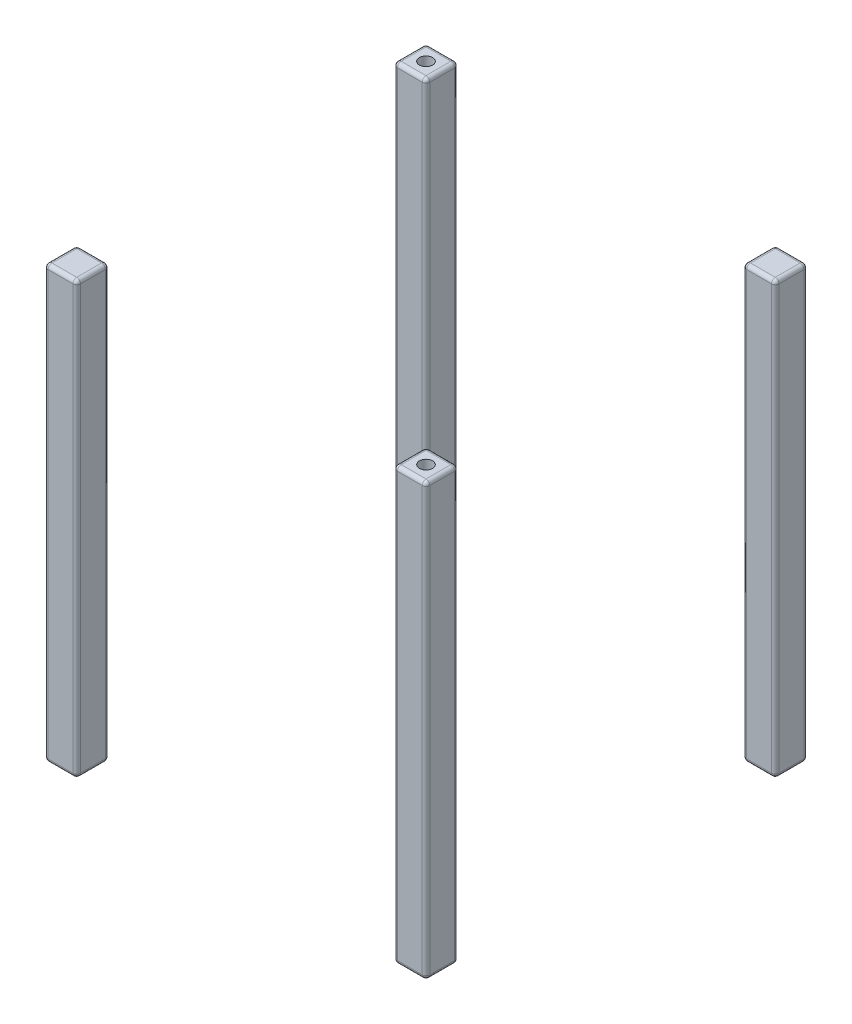
from build123d import *

# Parameters (mm, degrees)
BOSS_EXTRUDE1_DEPTH            = 113
BOSS_EXTRUDE1_2_DEPTH          = 113
BOSS_EXTRUDE1_3_DEPTH          = 113
BOSS_EXTRUDE1_4_DEPTH          = 113
FILLET1_R                      = 1
FILLET2_R                      = 1
FILLET3_R                      = 1
FILLET4_R                      = 1
F_8_32_TAPPED_HOLE1_AT_2_COUNT = 2
F_8_32_TAPPED_HOLE1_AT_2_PITCH = 129.400540957
F_8_32_TAPPED_HOLE2_AT_2_COUNT = 2
F_8_32_TAPPED_HOLE2_AT_2_PITCH = 129.400540957


with BuildPart() as part:
    # Sketch1 → Boss-Extrude1 (new body)
    with BuildSketch(Plane(origin=(0, 0, 0), x_dir=(1, 0, 0), z_dir=(0, 1, 0))):
        with BuildLine():
            Line((-49, 50), (-41.5, 50))
            Line((-41.5, 50), (-41.5, 41.5))
            Line((-41.5, 41.5), (-50, 41.5))
            Line((-50, 41.5), (-50, 49))
            ThreePointArc((-50, 49), (-49.707106781, 49.707106781), (-49, 50))
        make_face()
    extrude(amount=BOSS_EXTRUDE1_DEPTH)

    # Fillet3
    fillet3_edges = [part.edges().sort_by_distance(p)[0] for p in [
        (-41.5, 56.5, -50),
        (-50, 56.5, -41.5),
        (-41.5, 56.5, -41.5),
        (-45.75, 113, -41.5),
        (-50, 113, -45.25),
        (-49.707106781, 113, -49.707106781),
        (-45.25, 113, -50),
        (-41.5, 113, -45.75),
        (-45.75, 0, -41.5),
        (-50, 0, -45.25),
        (-49.707106781, 0, -49.707106781),
        (-45.25, 0, -50),
        (-41.5, 0, -45.75),
    ]]
    fillet(fillet3_edges, radius=FILLET3_R)

    # Sketch3 → #8-32 Tapped Hole1 (revolve, cut)
    with BuildSketch(Plane(origin=(-45.75, 113, -45.75), x_dir=(0, 0, 1), z_dir=(1, 0, 0))):
        Polygon((0, 0), (0, 12.213806461), (1.7272, 11.176), (1.7272, 0), align=None)
    f_8_32_tapped_hole1 = revolve(axis=Axis((-45.75, 119.35, -45.75), (0, -1, 0)), mode=Mode.SUBTRACT)


with BuildPart() as body_2:
    # Sketch1 → Boss-Extrude1 2 (new body)
    with BuildSketch(Plane(origin=(0, 0, 0), x_dir=(1, 0, 0), z_dir=(0, 1, 0))):
        with BuildLine():
            Line((-50, -41.5), (-41.5, -41.5))
            Line((-41.5, -41.5), (-41.5, -50))
            Line((-41.5, -50), (-49, -50))
            ThreePointArc((-49, -50), (-49.707106781, -49.707106781), (-50, -49))
            Line((-50, -49), (-50, -41.5))
        make_face()
    extrude(amount=BOSS_EXTRUDE1_2_DEPTH)

    # Fillet1
    fillet1_edges = [body_2.edges().sort_by_distance(p)[0] for p in [
        (-45.25, 0, 50),
        (-49.707106781, 0, 49.707106781),
        (-50, 113, 45.25),
        (-49.707106781, 113, 49.707106781),
        (-41.5, 56.5, 41.5),
        (-45.75, 113, 41.5),
        (-50, 56.5, 41.5),
        (-45.75, 0, 41.5),
        (-41.5, 0, 45.75),
        (-50, 0, 45.25),
        (-41.5, 56.5, 50),
        (-41.5, 113, 45.75),
        (-45.25, 113, 50),
    ]]
    fillet(fillet1_edges, radius=FILLET1_R)

    # Sketch5 → #8-32 Tapped Hole2 (revolve, cut)
    with BuildSketch(Plane(origin=(-45.75, 0, 45.75), x_dir=(0, 0, -1), z_dir=(1, 0, 0))):
        Polygon((0, 0), (0, 12.213806461), (1.7272, 11.176), (1.7272, 0), align=None)
    f_8_32_tapped_hole2 = revolve(axis=Axis((-45.75, -6.35, 45.75), (0, 1, 0)), mode=Mode.SUBTRACT)


with BuildPart() as body_3:
    # Sketch1 → Boss-Extrude1 3 (new body)
    with BuildSketch(Plane(origin=(0, 0, 0), x_dir=(1, 0, 0), z_dir=(0, 1, 0))):
        with BuildLine():
            Line((41.5, -41.5), (50, -41.5))
            Line((50, -41.5), (50, -49))
            ThreePointArc((50, -49), (49.707106781, -49.707106781), (49, -50))
            Line((49, -50), (41.5, -50))
            Line((41.5, -50), (41.5, -41.5))
        make_face()
    extrude(amount=BOSS_EXTRUDE1_3_DEPTH)

    # Fillet2
    fillet2_edges = [body_3.edges().sort_by_distance(p)[0] for p in [
        (41.5, 56.5, 50),
        (41.5, 56.5, 41.5),
        (45.25, 0, 50),
        (49.707106781, 0, 49.707106781),
        (45.75, 0, 41.5),
        (41.5, 0, 45.75),
        (45.75, 113, 41.5),
        (49.707106781, 113, 49.707106781),
        (45.25, 113, 50),
        (41.5, 113, 45.75),
        (50, 113, 45.25),
        (50, 56.5, 41.5),
        (50, 0, 45.25),
    ]]
    fillet(fillet2_edges, radius=FILLET2_R)

    # #8-32 Tapped Hole1 at 2: #8-32 Tapped Hole1 ×2
    with Locations(*[Vector(0.7071067811865477, 0, 0.7071067811865475) * (i * F_8_32_TAPPED_HOLE1_AT_2_PITCH) for i in range(1, F_8_32_TAPPED_HOLE1_AT_2_COUNT)]):
        add(f_8_32_tapped_hole1, mode=Mode.SUBTRACT)


with BuildPart() as body_4:
    # Sketch1 → Boss-Extrude1 4 (new body)
    with BuildSketch(Plane(origin=(0, 0, 0), x_dir=(1, 0, 0), z_dir=(0, 1, 0))):
        with BuildLine():
            Line((41.5, 50), (49, 50))
            ThreePointArc((49, 50), (49.707106781, 49.707106781), (50, 49))
            Line((50, 49), (50, 41.5))
            Line((50, 41.5), (41.5, 41.5))
            Line((41.5, 41.5), (41.5, 50))
        make_face()
    extrude(amount=BOSS_EXTRUDE1_4_DEPTH)

    # Fillet4
    fillet4_edges = [body_4.edges().sort_by_distance(p)[0] for p in [
        (41.5, 56.5, -41.5),
        (50, 56.5, -41.5),
        (41.5, 56.5, -50),
        (45.25, 113, -50),
        (49.707106781, 113, -49.707106781),
        (50, 113, -45.25),
        (45.75, 113, -41.5),
        (41.5, 113, -45.75),
        (45.25, 0, -50),
        (49.707106781, 0, -49.707106781),
        (50, 0, -45.25),
        (45.75, 0, -41.5),
        (41.5, 0, -45.75),
    ]]
    fillet(fillet4_edges, radius=FILLET4_R)

    # #8-32 Tapped Hole2 at 2: #8-32 Tapped Hole2 ×2
    with Locations(*[Vector(0.7071067811865475, 0, -0.7071067811865476) * (i * F_8_32_TAPPED_HOLE2_AT_2_PITCH) for i in range(1, F_8_32_TAPPED_HOLE2_AT_2_COUNT)]):
        add(f_8_32_tapped_hole2, mode=Mode.SUBTRACT)


solid = Compound([part.part, body_2.part, body_3.part, body_4.part])
